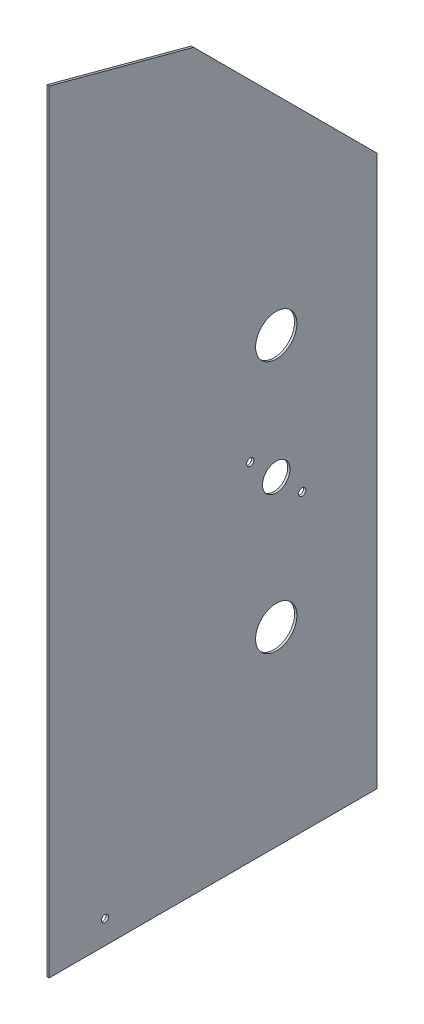
from build123d import *

# Parameters (mm, degrees)
BOSS_EXTRUDE1_OUTLINE_W   = 227.076
BOSS_EXTRUDE1_OUTLINE_H   = 508
BOSS_EXTRUDE1_OUTLINE_R   = 14.2875
BOSS_EXTRUDE1_OUTLINE_R_2 = 2.5527
BOSS_EXTRUDE1_OUTLINE_R_3 = 9.525
BOSS_EXTRUDE1_DEPTH       = 1.5875
F_8_CLEARANCE_HOLE1_D     = 4.9149
CHAMFER1_SIZE             = 127
BOSS_EXTRUDE2_DEPTH       = 1.5875


# Read off the part's stored shape, not the designer's step: Boss-Extrude1
with BuildPart() as part:
    # Boss-Extrude1 outline → Boss-Extrude1 (new body)
    with BuildSketch(Plane(origin=(0, 0, 0), x_dir=(0, 0, -1), z_dir=(1, 0, 0))):
        Rectangle(BOSS_EXTRUDE1_OUTLINE_W, BOSS_EXTRUDE1_OUTLINE_H)
        with Locations((43.688, -122.2375)):
            Circle(BOSS_EXTRUDE1_OUTLINE_R, mode=Mode.SUBTRACT)
        with Locations((25.727487758, -14.254307758)):
            Circle(BOSS_EXTRUDE1_OUTLINE_R_2, mode=Mode.SUBTRACT)
        with Locations((43.688, -32.21482)):
            Circle(BOSS_EXTRUDE1_OUTLINE_R_3, mode=Mode.SUBTRACT)
        with Locations((61.648512242, -50.175332242)):
            Circle(BOSS_EXTRUDE1_OUTLINE_R_2, mode=Mode.SUBTRACT)
        with Locations((43.688, 52.78628)):
            Circle(BOSS_EXTRUDE1_OUTLINE_R, mode=Mode.SUBTRACT)
    extrude(amount=BOSS_EXTRUDE1_DEPTH)

    # #8 Clearance Hole1 (through all)
    with Locations(Plane(origin=(1.5875, 0, 0), x_dir=(0, 0, -1), z_dir=(1, 0, 0))):
        with Locations((-74.877168, -237.687866)):
            Hole(F_8_CLEARANCE_HOLE1_D / 2)

    # Chamfer1
    chamfer1_edges = [part.edges().sort_by_distance(p)[0] for p in [
        (0.79375, 254, -113.538),
    ]]
    chamfer(chamfer1_edges, length=CHAMFER1_SIZE)

    # Sketch7 → Boss-Extrude2 (add, through all)
    with BuildSketch(Plane(origin=(1.5875, 0, 0), x_dir=(0, 0, -1), z_dir=(1, 0, 0))):
        Polygon((-113.538, 254), (-113.538, 280.815283382), (-13.462, 254), align=None)
    extrude(amount=-BOSS_EXTRUDE2_DEPTH)


solid = part.part
